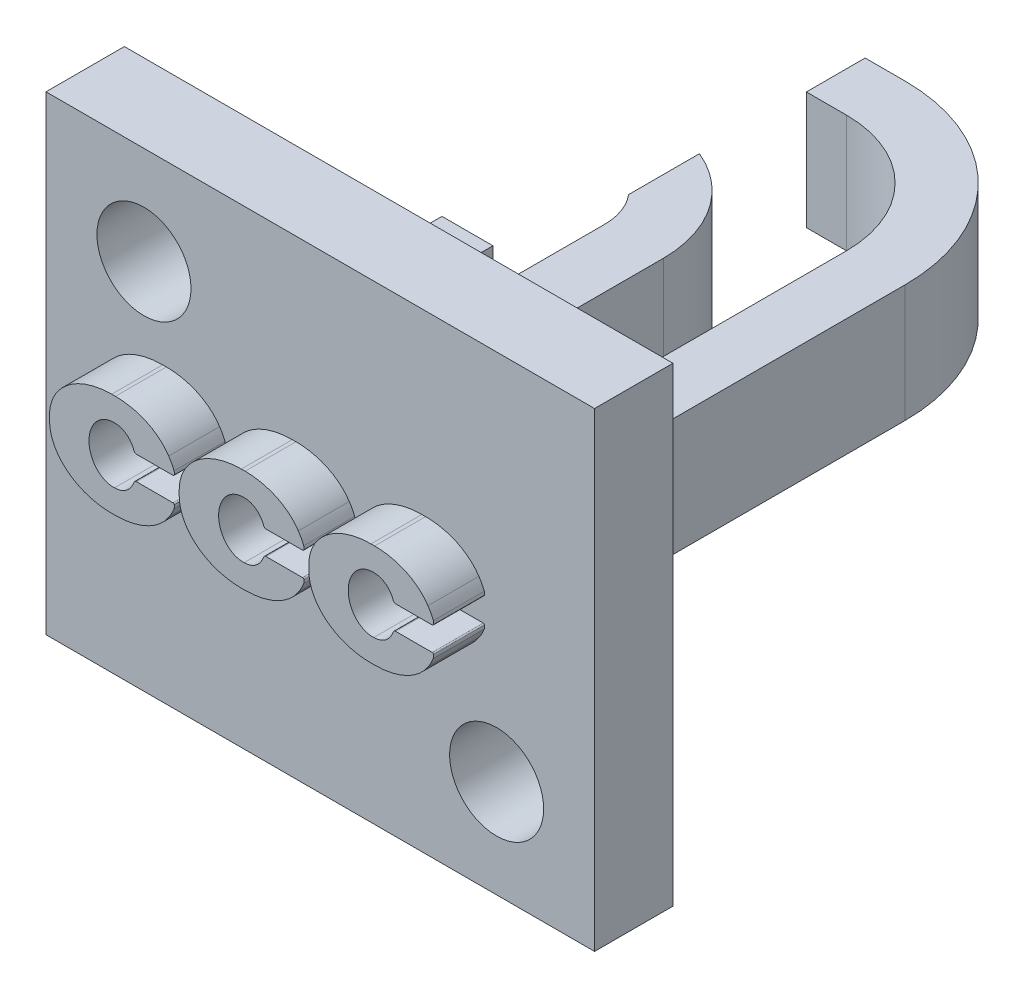
from build123d import *

# Parameters (mm, degrees)
SKETCH1_W           = 15
SKETCH1_H           = 12
BOSS_EXTRUDE1_DEPTH = 2
BOSS_EXTRUDE2_DEPTH = 2
SKETCH3_W           = 1.5
SKETCH3_H           = 4.8
BOSS_EXTRUDE3_DEPTH = 1.5
FILLET3_R           = 1.5
FILLET4_R           = 3
FILLET5_R           = 3
FILLET6_R           = 4.5
SKETCH4_W           = 2
SKETCH4_H           = 12
CUT_EXTRUDE1_DEPTH  = 1
SKETCH5_R           = 1.2
CUT_EXTRUDE2_DEPTH  = 17.731407672
CUT_EXTRUDE3_START  = -0.7
CUT_EXTRUDE3_DEPTH  = 0.7
SKETCH7_W           = 1.148621372
SKETCH7_H           = 6.2
CUT_EXTRUDE4_DEPTH  = 18.325992122
SKETCH8_W           = 0.2
SKETCH8_H           = 4.8
CUT_EXTRUDE5_DEPTH  = 18.325992122


with BuildPart() as part:
    # Sketch1 → Boss-Extrude1 (new body)
    with BuildSketch(Plane.XY):
        Rectangle(SKETCH1_W, SKETCH1_H)
    extrude(amount=BOSS_EXTRUDE1_DEPTH)

    # Sketch2 → Boss-Extrude2 (add)
    with BuildSketch(Plane.XY.offset(2)):
        with BuildLine():
            Line((-0.583484164, 0.443787032), (0.352350759, 0.443787032))
            ThreePointArc((0.352350759, 0.443787032), (0.370660979, 0.451874829), (0.381594807, 0.468641703))
            ThreePointArc((0.381594807, 0.468641703), (0.38478126, 0.512633483), (0.377406248, 0.556119567))
            ThreePointArc((0.377406248, 0.556119567), (0.316958398, 0.689104808), (0.240244136, 0.81341868))
            add(Edge.make_bspline(
                [(0.240244136, 0.81341868), (-0.178053426, 1.454553053), (-1.120854898, 1.454553053)],
                knots=[3.484341046, 3.484341046, 3.484341046, 4.522924348, 4.522924348, 4.522924348], degree=2, weights=[1, 0.868170926, 1]))
            Line((-1.120854898, 1.454553053), (-1.214475951, 1.454553068))
            add(Edge.make_bspline(
                [(-1.214475951, 1.454553068), (-2.800132813, 1.454553068), (-2.800132813, 0.203397992)],
                knots=[1.670440536, 1.670440536, 1.670440536, 3.203377674, 3.203377674, 3.203377674], degree=2, weights=[1, 0.720364542, 1]))
            Line((-2.800132813, 0.203397992), (-2.800132806, 0.073267738))
            add(Edge.make_bspline(
                [(-2.800132806, 0.073267738), (-2.800132806, -1.177887338), (-1.214475944, -1.177887338)],
                knots=[3.079807634, 3.079807634, 3.079807634, 4.612744771, 4.612744771, 4.612744771], degree=2, weights=[1, 0.720364542, 1]))
            Line((-1.214475944, -1.177887338), (-1.120854891, -1.177887375))
            add(Edge.make_bspline(
                [(-1.120854891, -1.177887375), (-0.178053419, -1.177887375), (0.240244143, -0.536753002)],
                knots=[1.760260959, 1.760260959, 1.760260959, 2.798844261, 2.798844261, 2.798844261], degree=2, weights=[1, 0.868170926, 1]))
            ThreePointArc((0.240244143, -0.536753002), (0.313994237, -0.417650167), (0.372658208, -0.290437354))
            ThreePointArc((0.372658208, -0.290437354), (0.384251196, -0.24211404), (0.382489087, -0.192450825))
            ThreePointArc((0.382489087, -0.192450825), (0.370484527, -0.171527836), (0.347824512, -0.163257123))
            Line((0.347824512, -0.163257123), (-0.58348421, -0.163257123))
            ThreePointArc((-0.58348421, -0.163257123), (-0.62125204, -0.175257922), (-0.645165579, -0.206858093))
            add(Edge.make_bspline(
                [(-1.141657158, -0.577741646), (-0.776549247, -0.578100851), (-0.645165579, -0.206858093)],
                knots=[5.955155363, 5.955155363, 5.955155363, 7.020735545, 7.020735545, 7.020735545], degree=2, weights=[1, 0.86139323, 1]))
            add(Edge.make_bspline(
                [(-1.201450314, 0.854894524), (-1.823540048, 0.823436889), (-1.793554178, 0.104979402), (-1.763568309, -0.613478086), (-1.141657158, -0.577741646)],
                knots=[0.039432941, 0.039432941, 0.039432941, 1.613207044, 1.613207044, 3.186981147, 3.186981147, 3.186981147], degree=2, weights=[1, 0.706053195, 1, 0.706053195, 1]))
            add(Edge.make_bspline(
                [(-0.645165584, 0.487388037), (-0.79140441, 0.900606071), (-1.201450314, 0.854894524)],
                knots=[2.404042441, 2.404042441, 2.404042441, 3.565685694, 3.565685694, 3.565685694], degree=2, weights=[1, 0.836012096, 1]))
            ThreePointArc((-0.645165584, 0.487388037), (-0.621252025, 0.455787841), (-0.583484164, 0.443787032))
        make_face()
        with BuildLine():
            Line((-3.89178871, 0.443787032), (-2.955953786, 0.443787032))
            ThreePointArc((-2.955953786, 0.443787032), (-2.937643536, 0.451874816), (-2.926709688, 0.468641703))
            ThreePointArc((-2.926709688, 0.468641703), (-2.923523234, 0.512633483), (-2.930898247, 0.556119567))
            ThreePointArc((-2.930898247, 0.556119567), (-2.991346096, 0.689104808), (-3.068060358, 0.81341868))
            add(Edge.make_bspline(
                [(-3.068060358, 0.81341868), (-3.48635792, 1.454553053), (-4.429159392, 1.454553053)],
                knots=[3.484341046, 3.484341046, 3.484341046, 4.522924348, 4.522924348, 4.522924348], degree=2, weights=[1, 0.868170926, 1]))
            Line((-4.429159392, 1.454553053), (-4.522780446, 1.454553068))
            add(Edge.make_bspline(
                [(-4.522780446, 1.454553068), (-6.108437307, 1.454553068), (-6.108437307, 0.203397992)],
                knots=[4.81203319, 4.81203319, 4.81203319, 6.344970327, 6.344970327, 6.344970327], degree=2, weights=[1, 0.720364542, 1]))
            Line((-6.108437307, 0.203397992), (-6.108437352, 0.073267738))
            add(Edge.make_bspline(
                [(-6.108437352, 0.073267738), (-6.108437352, -1.177887338), (-4.52278049, -1.177887338)],
                knots=[6.221400287, 6.221400287, 6.221400287, 7.754337425, 7.754337425, 7.754337425], degree=2, weights=[1, 0.720364542, 1]))
            Line((-4.52278049, -1.177887338), (-4.429159437, -1.177887375))
            add(Edge.make_bspline(
                [(-4.429159437, -1.177887375), (-3.486357965, -1.177887375), (-3.068060402, -0.536753002)],
                knots=[1.760260959, 1.760260959, 1.760260959, 2.798844261, 2.798844261, 2.798844261], degree=2, weights=[1, 0.868170926, 1]))
            ThreePointArc((-3.068060402, -0.536753002), (-2.994310308, -0.417650167), (-2.935646337, -0.290437354))
            ThreePointArc((-2.935646337, -0.290437354), (-2.92405335, -0.24211404), (-2.925815458, -0.192450825))
            ThreePointArc((-2.925815458, -0.192450825), (-2.937820019, -0.171527836), (-2.960480033, -0.163257123))
            Line((-2.960480033, -0.163257123), (-3.891788755, -0.163257123))
            ThreePointArc((-3.891788755, -0.163257123), (-3.929556585, -0.175257922), (-3.953470124, -0.206858093))
            add(Edge.make_bspline(
                [(-4.449961703, -0.577741646), (-4.084853792, -0.578100851), (-3.953470124, -0.206858093)],
                knots=[5.955155363, 5.955155363, 5.955155363, 7.020735545, 7.020735545, 7.020735545], degree=2, weights=[1, 0.86139323, 1]))
            add(Edge.make_bspline(
                [(-4.509754859, 0.854894524), (-5.131844593, 0.82343689), (-5.101858724, 0.104979402), (-5.071872854, -0.613478086), (-4.449961703, -0.577741646)],
                knots=[0.039432941, 0.039432941, 0.039432941, 1.613207044, 1.613207044, 3.186981147, 3.186981147, 3.186981147], degree=2, weights=[1, 0.706053195, 1, 0.706053195, 1]))
            add(Edge.make_bspline(
                [(-3.95347013, 0.487388037), (-4.099708956, 0.900606071), (-4.509754859, 0.854894524)],
                knots=[2.40404244, 2.40404244, 2.40404244, 3.565685694, 3.565685694, 3.565685694], degree=2, weights=[1, 0.836012096, 1]))
            ThreePointArc((-3.95347013, 0.487388037), (-3.92955657, 0.455787841), (-3.89178871, 0.443787032))
        make_face()
        with BuildLine():
            Line((2.724820382, 0.443787032), (3.660655305, 0.443787032))
            ThreePointArc((3.660655305, 0.443787032), (3.678965525, 0.451874829), (3.689899353, 0.468641703))
            ThreePointArc((3.689899353, 0.468641703), (3.693085806, 0.512633483), (3.685710794, 0.556119567))
            ThreePointArc((3.685710794, 0.556119567), (3.625262944, 0.689104808), (3.548548682, 0.81341868))
            add(Edge.make_bspline(
                [(3.548548682, 0.81341868), (3.13025112, 1.454553053), (2.187449648, 1.454553053)],
                knots=[0.342748392, 0.342748392, 0.342748392, 1.381331695, 1.381331695, 1.381331695], degree=2, weights=[1, 0.868170926, 1]))
            Line((2.187449648, 1.454553053), (2.093828595, 1.454553068))
            add(Edge.make_bspline(
                [(2.093828595, 1.454553068), (0.508171733, 1.454553068), (0.508171733, 0.203397992)],
                knots=[4.81203319, 4.81203319, 4.81203319, 6.344970327, 6.344970327, 6.344970327], degree=2, weights=[1, 0.720364542, 1]))
            Line((0.508171733, 0.203397992), (0.50817174, 0.073267738))
            add(Edge.make_bspline(
                [(0.50817174, 0.073267738), (0.50817174, -1.177887338), (2.093828602, -1.177887338)],
                knots=[3.079807634, 3.079807634, 3.079807634, 4.612744771, 4.612744771, 4.612744771], degree=2, weights=[1, 0.720364542, 1]))
            Line((2.093828602, -1.177887338), (2.187449655, -1.177887375))
            add(Edge.make_bspline(
                [(2.187449655, -1.177887375), (3.130251127, -1.177887375), (3.548548689, -0.536753002)],
                knots=[1.760260959, 1.760260959, 1.760260959, 2.798844261, 2.798844261, 2.798844261], degree=2, weights=[1, 0.868170926, 1]))
            ThreePointArc((3.548548689, -0.536753002), (3.622298783, -0.417650167), (3.680962754, -0.290437354))
            ThreePointArc((3.680962754, -0.290437354), (3.692555742, -0.24211404), (3.690793633, -0.192450825))
            ThreePointArc((3.690793633, -0.192450825), (3.678789073, -0.171527836), (3.656129058, -0.163257123))
            Line((3.656129058, -0.163257123), (2.724820336, -0.163257123))
            ThreePointArc((2.724820336, -0.163257123), (2.687052506, -0.175257922), (2.663138967, -0.206858093))
            add(Edge.make_bspline(
                [(2.166647388, -0.577741646), (2.531755299, -0.578100851), (2.663138967, -0.206858093)],
                knots=[5.955155363, 5.955155363, 5.955155363, 7.020735545, 7.020735545, 7.020735545], degree=2, weights=[1, 0.86139323, 1]))
            add(Edge.make_bspline(
                [(2.106854232, 0.854894524), (1.484764498, 0.823436889), (1.514750368, 0.104979402), (1.544736237, -0.613478086), (2.166647388, -0.577741646)],
                knots=[3.181025595, 3.181025595, 3.181025595, 4.754799698, 4.754799698, 6.328573801, 6.328573801, 6.328573801], degree=2, weights=[1, 0.706053195, 1, 0.706053195, 1]))
            add(Edge.make_bspline(
                [(2.663138962, 0.487388037), (2.516900136, 0.900606071), (2.106854232, 0.854894524)],
                knots=[5.545635094, 5.545635094, 5.545635094, 6.707278348, 6.707278348, 6.707278348], degree=2, weights=[1, 0.836012096, 1]))
            ThreePointArc((2.663138962, 0.487388037), (2.687052521, 0.455787841), (2.724820382, 0.443787032))
        make_face()
    extrude(amount=BOSS_EXTRUDE2_DEPTH)

    # Sketch3 → Boss-Extrude3 (add, symmetric)
    with BuildSketch(Plane(origin=(0, 0, 0), x_dir=(1, 0, 0), z_dir=(0, 1, 0))):
        Polygon((1.72873188, 0), (3.22873188, 0), (3.22873188, 13.7), (-3.442646753, 13.7), (-3.442646753, 12.2), (1.72873188, 12.2), align=None)
        with Locations((-3.644025381, 2.4)):
            Rectangle(SKETCH3_W, SKETCH3_H)
        Polygon((-1.942646753, 0), (-0.442646753, 0), (-0.442646753, 9.7), (-3.442646753, 9.7), (-3.442646753, 8.2), (-1.942646753, 8.2), align=None)
    extrude(amount=BOSS_EXTRUDE3_DEPTH, both=True)

    # Fillet3
    fillet3_edges = [part.edges().sort_by_distance(p)[0] for p in [
        (-1.942646753, 0, -8.2),
    ]]
    fillet(fillet3_edges, radius=FILLET3_R - 0.0001)  # a hair under: the kernel refuses the full size

    # Fillet4
    fillet4_edges = [part.edges().sort_by_distance(p)[0] for p in [
        (-0.442646753, 0, -9.7),
    ]]
    fillet(fillet4_edges, radius=FILLET4_R - 0.0001)  # a hair under: the kernel refuses the full size

    # Fillet5
    fillet5_edges = [part.edges().sort_by_distance(p)[0] for p in [
        (1.72873188, 0, -12.2),
    ]]
    fillet(fillet5_edges, radius=FILLET5_R)

    # Fillet6
    fillet6_edges = [part.edges().sort_by_distance(p)[0] for p in [
        (3.22873188, 0, -13.7),
    ]]
    fillet(fillet6_edges, radius=FILLET6_R)

    # Sketch4 → Cut-Extrude1 (cut)
    with BuildSketch(Plane(origin=(7.5, 0, 0), x_dir=(0, 0, -1), z_dir=(1, 0, 0))):
        with Locations((-1, 0)):
            Rectangle(SKETCH4_W, SKETCH4_H)
    extrude(amount=-CUT_EXTRUDE1_DEPTH, mode=Mode.SUBTRACT)

    # Sketch5 → Cut-Extrude2 (cut, through all)
    with BuildSketch(Plane(origin=(0, 0, 0), x_dir=(-1, 0, 0), z_dir=(0, 0, -1))):
        with Locations((-4, -3.5)):
            Circle(SKETCH5_R)
        with Locations((5, 3.5)):
            Circle(SKETCH5_R)
    extrude(amount=-CUT_EXTRUDE2_DEPTH, mode=Mode.SUBTRACT)

    # Sketch6 → Cut-Extrude3 (cut)
    with BuildSketch(Plane.XY.offset(4).offset(CUT_EXTRUDE3_START)):
        with BuildLine():
            Line((2.724820382, 0.443787032), (3.660655305, 0.443787032))
            ThreePointArc((3.660655305, 0.443787032), (3.678965525, 0.451874829), (3.689899353, 0.468641703))
            ThreePointArc((3.689899353, 0.468641703), (3.693085806, 0.512633483), (3.685710794, 0.556119567))
            ThreePointArc((3.685710794, 0.556119567), (3.625262944, 0.689104808), (3.548548682, 0.81341868))
            add(Edge.make_bspline(
                [(3.548548682, 0.81341868), (3.13025112, 1.454553053), (2.187449648, 1.454553053)],
                knots=[0.342748392, 0.342748392, 0.342748392, 1.381331695, 1.381331695, 1.381331695], degree=2, weights=[1, 0.868170926, 1]))
            Line((2.187449648, 1.454553053), (2.093828595, 1.454553068))
            add(Edge.make_bspline(
                [(2.093828595, 1.454553068), (0.508171733, 1.454553068), (0.508171733, 0.203397992)],
                knots=[4.81203319, 4.81203319, 4.81203319, 6.344970327, 6.344970327, 6.344970327], degree=2, weights=[1, 0.720364542, 1]))
            Line((0.508171733, 0.203397992), (0.50817174, 0.073267738))
            add(Edge.make_bspline(
                [(0.50817174, 0.073267738), (0.50817174, -1.177887338), (2.093828602, -1.177887338)],
                knots=[3.079807634, 3.079807634, 3.079807634, 4.612744771, 4.612744771, 4.612744771], degree=2, weights=[1, 0.720364542, 1]))
            Line((2.093828602, -1.177887338), (2.187449655, -1.177887375))
            add(Edge.make_bspline(
                [(2.187449655, -1.177887375), (3.130251127, -1.177887375), (3.548548689, -0.536753002)],
                knots=[1.760260959, 1.760260959, 1.760260959, 2.798844261, 2.798844261, 2.798844261], degree=2, weights=[1, 0.868170926, 1]))
            ThreePointArc((3.548548689, -0.536753002), (3.622298783, -0.417650167), (3.680962754, -0.290437354))
            ThreePointArc((3.680962754, -0.290437354), (3.692555742, -0.24211404), (3.690793633, -0.192450825))
            ThreePointArc((3.690793633, -0.192450825), (3.678789073, -0.171527836), (3.656129058, -0.163257123))
            Line((3.656129058, -0.163257123), (2.724820336, -0.163257123))
            ThreePointArc((2.724820336, -0.163257123), (2.687052506, -0.175257922), (2.663138967, -0.206858093))
            add(Edge.make_bspline(
                [(2.166647388, -0.577741646), (2.531755299, -0.578100851), (2.663138967, -0.206858093)],
                knots=[5.955155363, 5.955155363, 5.955155363, 7.020735545, 7.020735545, 7.020735545], degree=2, weights=[1, 0.86139323, 1]))
            add(Edge.make_bspline(
                [(2.106854232, 0.854894524), (1.484764498, 0.823436889), (1.514750368, 0.104979402), (1.544736237, -0.613478086), (2.166647388, -0.577741646)],
                knots=[3.181025595, 3.181025595, 3.181025595, 4.754799698, 4.754799698, 6.328573801, 6.328573801, 6.328573801], degree=2, weights=[1, 0.706053195, 1, 0.706053195, 1]))
            add(Edge.make_bspline(
                [(2.663138962, 0.487388037), (2.516900136, 0.900606071), (2.106854232, 0.854894524)],
                knots=[2.404042441, 2.404042441, 2.404042441, 3.565685694, 3.565685694, 3.565685694], degree=2, weights=[1, 0.836012096, 1]))
            ThreePointArc((2.663138962, 0.487388037), (2.687052521, 0.455787841), (2.724820382, 0.443787032))
        make_face()
        with BuildLine():
            Line((-0.583484164, 0.443787032), (0.352350759, 0.443787032))
            ThreePointArc((0.352350759, 0.443787032), (0.370660979, 0.451874829), (0.381594807, 0.468641703))
            ThreePointArc((0.381594807, 0.468641703), (0.38478126, 0.512633483), (0.377406248, 0.556119567))
            ThreePointArc((0.377406248, 0.556119567), (0.316958398, 0.689104808), (0.240244136, 0.81341868))
            add(Edge.make_bspline(
                [(0.240244136, 0.81341868), (-0.178053426, 1.454553053), (-1.120854898, 1.454553053)],
                knots=[0.342748392, 0.342748392, 0.342748392, 1.381331695, 1.381331695, 1.381331695], degree=2, weights=[1, 0.868170926, 1]))
            Line((-1.120854898, 1.454553053), (-1.214475951, 1.454553068))
            add(Edge.make_bspline(
                [(-1.214475951, 1.454553068), (-2.800132813, 1.454553068), (-2.800132813, 0.203397992)],
                knots=[4.81203319, 4.81203319, 4.81203319, 6.344970327, 6.344970327, 6.344970327], degree=2, weights=[1, 0.720364542, 1]))
            Line((-2.800132813, 0.203397992), (-2.800132806, 0.073267738))
            add(Edge.make_bspline(
                [(-2.800132806, 0.073267738), (-2.800132806, -1.177887338), (-1.214475944, -1.177887338)],
                knots=[3.079807634, 3.079807634, 3.079807634, 4.612744771, 4.612744771, 4.612744771], degree=2, weights=[1, 0.720364542, 1]))
            Line((-1.214475944, -1.177887338), (-1.120854891, -1.177887375))
            add(Edge.make_bspline(
                [(-1.120854891, -1.177887375), (-0.178053419, -1.177887375), (0.240244143, -0.536753002)],
                knots=[1.760260959, 1.760260959, 1.760260959, 2.798844261, 2.798844261, 2.798844261], degree=2, weights=[1, 0.868170926, 1]))
            ThreePointArc((0.240244143, -0.536753002), (0.313994237, -0.417650167), (0.372658208, -0.290437354))
            ThreePointArc((0.372658208, -0.290437354), (0.384251196, -0.24211404), (0.382489087, -0.192450825))
            ThreePointArc((0.382489087, -0.192450825), (0.370484527, -0.171527836), (0.347824512, -0.163257123))
            Line((0.347824512, -0.163257123), (-0.58348421, -0.163257123))
            ThreePointArc((-0.58348421, -0.163257123), (-0.62125204, -0.175257922), (-0.645165579, -0.206858093))
            add(Edge.make_bspline(
                [(-1.141657158, -0.577741646), (-0.776549247, -0.578100851), (-0.645165579, -0.206858093)],
                knots=[5.955155363, 5.955155363, 5.955155363, 7.020735545, 7.020735545, 7.020735545], degree=2, weights=[1, 0.86139323, 1]))
            add(Edge.make_bspline(
                [(-1.201450314, 0.854894524), (-1.823540048, 0.823436889), (-1.793554178, 0.104979402), (-1.763568309, -0.613478086), (-1.141657158, -0.577741646)],
                knots=[3.181025595, 3.181025595, 3.181025595, 4.754799698, 4.754799698, 6.328573801, 6.328573801, 6.328573801], degree=2, weights=[1, 0.706053195, 1, 0.706053195, 1]))
            add(Edge.make_bspline(
                [(-0.645165584, 0.487388037), (-0.79140441, 0.900606071), (-1.201450314, 0.854894524)],
                knots=[2.404042441, 2.404042441, 2.404042441, 3.565685694, 3.565685694, 3.565685694], degree=2, weights=[1, 0.836012096, 1]))
            ThreePointArc((-0.645165584, 0.487388037), (-0.621252025, 0.455787841), (-0.583484164, 0.443787032))
        make_face()
        with BuildLine():
            Line((-3.89178871, 0.443787032), (-2.955953786, 0.443787032))
            ThreePointArc((-2.955953786, 0.443787032), (-2.937643536, 0.451874816), (-2.926709688, 0.468641703))
            ThreePointArc((-2.926709688, 0.468641703), (-2.923523234, 0.512633483), (-2.930898247, 0.556119567))
            ThreePointArc((-2.930898247, 0.556119567), (-2.991346096, 0.689104808), (-3.068060358, 0.81341868))
            add(Edge.make_bspline(
                [(-3.068060358, 0.81341868), (-3.48635792, 1.454553053), (-4.429159392, 1.454553053)],
                knots=[0.342748392, 0.342748392, 0.342748392, 1.381331695, 1.381331695, 1.381331695], degree=2, weights=[1, 0.868170926, 1]))
            Line((-4.429159392, 1.454553053), (-4.522780446, 1.454553068))
            add(Edge.make_bspline(
                [(-4.522780446, 1.454553068), (-6.108437307, 1.454553068), (-6.108437307, 0.203397992)],
                knots=[4.81203319, 4.81203319, 4.81203319, 6.344970327, 6.344970327, 6.344970327], degree=2, weights=[1, 0.720364542, 1]))
            Line((-6.108437307, 0.203397992), (-6.108437352, 0.073267738))
            add(Edge.make_bspline(
                [(-6.108437352, 0.073267738), (-6.108437352, -1.177887338), (-4.52278049, -1.177887338)],
                knots=[3.079807634, 3.079807634, 3.079807634, 4.612744771, 4.612744771, 4.612744771], degree=2, weights=[1, 0.720364542, 1]))
            Line((-4.52278049, -1.177887338), (-4.429159437, -1.177887375))
            add(Edge.make_bspline(
                [(-4.429159437, -1.177887375), (-3.486357965, -1.177887375), (-3.068060402, -0.536753002)],
                knots=[1.760260959, 1.760260959, 1.760260959, 2.798844261, 2.798844261, 2.798844261], degree=2, weights=[1, 0.868170926, 1]))
            ThreePointArc((-3.068060402, -0.536753002), (-2.994310308, -0.417650167), (-2.935646337, -0.290437354))
            ThreePointArc((-2.935646337, -0.290437354), (-2.92405335, -0.24211404), (-2.925815458, -0.192450825))
            ThreePointArc((-2.925815458, -0.192450825), (-2.937820019, -0.171527836), (-2.960480033, -0.163257123))
            Line((-2.960480033, -0.163257123), (-3.891788755, -0.163257123))
            ThreePointArc((-3.891788755, -0.163257123), (-3.929556585, -0.175257922), (-3.953470124, -0.206858093))
            add(Edge.make_bspline(
                [(-4.449961703, -0.577741646), (-4.084853792, -0.578100851), (-3.953470124, -0.206858093)],
                knots=[5.955155363, 5.955155363, 5.955155363, 7.020735545, 7.020735545, 7.020735545], degree=2, weights=[1, 0.86139323, 1]))
            add(Edge.make_bspline(
                [(-4.509754859, 0.854894524), (-5.131844593, 0.82343689), (-5.101858724, 0.104979402), (-5.071872854, -0.613478086), (-4.449961703, -0.577741646)],
                knots=[3.181025595, 3.181025595, 3.181025595, 4.754799698, 4.754799698, 6.328573801, 6.328573801, 6.328573801], degree=2, weights=[1, 0.706053195, 1, 0.706053195, 1]))
            add(Edge.make_bspline(
                [(-3.95347013, 0.487388037), (-4.099708956, 0.900606071), (-4.509754859, 0.854894524)],
                knots=[2.40404244, 2.40404244, 2.40404244, 3.565685694, 3.565685694, 3.565685694], degree=2, weights=[1, 0.836012096, 1]))
            ThreePointArc((-3.95347013, 0.487388037), (-3.92955657, 0.455787841), (-3.89178871, 0.443787032))
        make_face()
    extrude(amount=CUT_EXTRUDE3_DEPTH, mode=Mode.SUBTRACT)

    # Sketch7 → Cut-Extrude4 (cut, through all)
    with BuildSketch(Plane(origin=(0, 1.5, 0), x_dir=(1, 0, 0), z_dir=(0, 1, 0))):
        with Locations((-2.868336067, 10.6)):
            Rectangle(SKETCH7_W, SKETCH7_H)
    extrude(amount=-CUT_EXTRUDE4_DEPTH, mode=Mode.SUBTRACT)

    # Sketch8 → Cut-Extrude5 (cut, through all)
    with BuildSketch(Plane(origin=(0, 1.5, 0), x_dir=(1, 0, 0), z_dir=(0, 1, 0))):
        with Locations((-4.294025381, 2.4)):
            Rectangle(SKETCH8_W, SKETCH8_H)
    extrude(amount=-CUT_EXTRUDE5_DEPTH, mode=Mode.SUBTRACT)


solid = part.part
